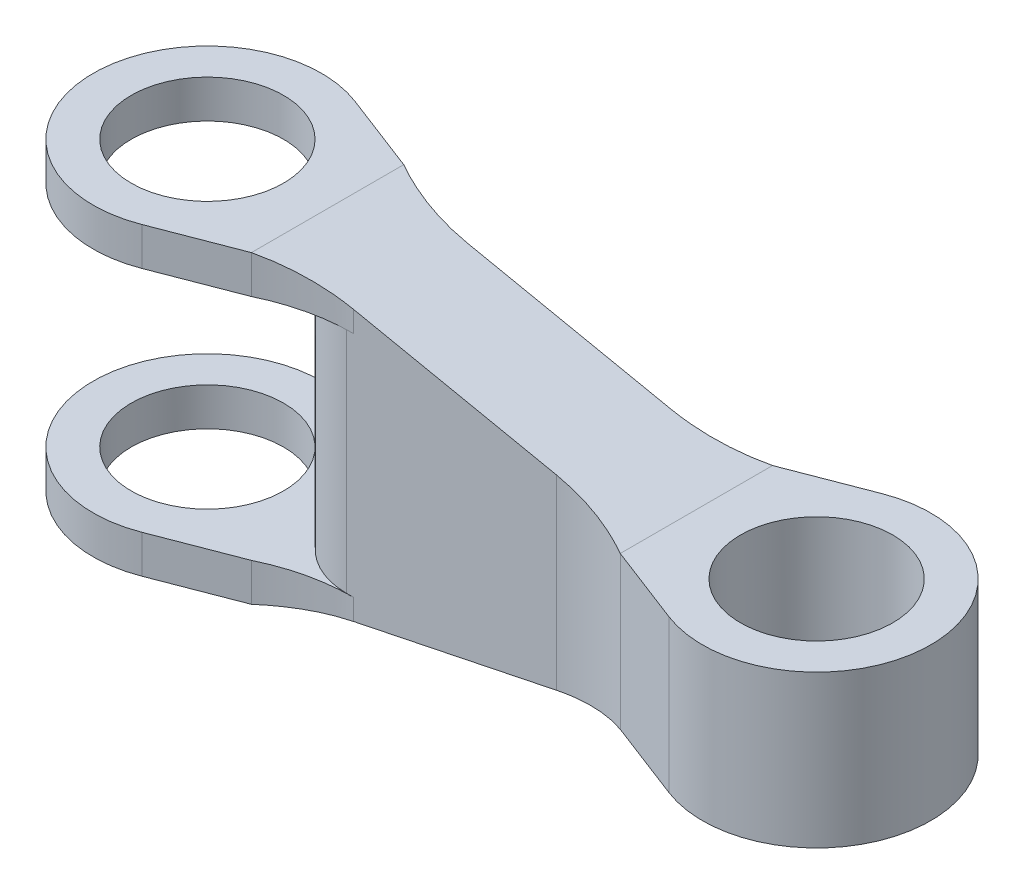
from build123d import *

# Parameters (mm, degrees)
SKETCH1_R           = 5.08
BOSS_EXTRUDE1_DEPTH = 10.16
SKETCH2_W           = 15.638324702
SKETCH2_H           = 15.24
CUT_EXTRUDE1_DEPTH  = 54.836616721
FILLET1_R           = 12.7
FILLET2_R           = 5.08


with BuildPart() as part:
    # Sketch1 → Boss-Extrude1 (new, symmetric)
    with BuildSketch(Plane(origin=(0, 0, 0), x_dir=(1, 0, 0), z_dir=(0, 1, 0))):
        with BuildLine():
            Line((2.735663722, 7.112), (8.018324702, 5.08))
            Line((8.018324702, 5.08), (8.018324702, 3.81))
            Line((8.018324702, 3.81), (32.621675298, 3.81))
            Line((32.621675298, 3.81), (32.621675298, 5.08))
            Line((32.621675298, 5.08), (37.904336278, 7.112))
            ThreePointArc((37.904336278, 7.112), (48.26, 0), (37.904336278, -7.112))
            Line((37.904336278, -7.112), (32.621675298, -5.08))
            Line((32.621675298, -5.08), (32.621675298, -3.81))
            Line((32.621675298, -3.81), (8.018324702, -3.81))
            Line((8.018324702, -3.81), (8.018324702, -5.08))
            Line((8.018324702, -5.08), (2.735663722, -7.112))
            ThreePointArc((2.735663722, -7.112), (-7.62, 0), (2.735663722, 7.112))
        make_face()
        with Locations(Location((0, 0, 0), (0, 0, 270))):
            Circle(SKETCH1_R, mode=Mode.SUBTRACT)
        with Locations(Location((40.64, 0, 0), (0, 0, 270))):
            Circle(SKETCH1_R, mode=Mode.SUBTRACT)
    extrude(amount=BOSS_EXTRUDE1_DEPTH, both=True)

    # Sketch2 → Cut-Extrude1 (cut, through all)
    with BuildSketch(Plane.XY.offset(13.97)):
        Polygon((8.018324702, 10.16), (32.621675298, 5.08), (48.26, 5.08), (48.26, 10.16), align=None)
        with Locations((0.199162351, 0)):
            Rectangle(SKETCH2_W, SKETCH2_H)
        Polygon((48.26, -10.16), (48.26, -5.08), (32.621675298, -5.08), (8.018324702, -10.16), align=None)
    extrude(amount=-CUT_EXTRUDE1_DEPTH, mode=Mode.SUBTRACT)

    # Fillet1
    # the kernel refuses this fillet: 12.7 mm, written as the material it adds along each edge
    with BuildSketch(Plane(origin=(32.621675298, 18.919504146, 3.81), x_dir=(-1, 0, 0), z_dir=(0, -1, 0))) as fillet1_piece_1_section:
        with BuildLine():
            CenterArc((5.535801658, -12.7), FILLET1_R, 90, 25.841932763)
            Line((0, -1.27), (0, 0))
            Line((0, 0), (5.535801658, 0))
        make_face()
    fillet1_piece_1 = extrude(amount=37.839008291, mode=Mode.PRIVATE)
    fillet1_piece_1 = split(fillet1_piece_1, bisect_by=Plane(origin=(37.374376864, -4.098681465, 3.81), z_dir=(-0.20221057606968723, 0.9793420663514691, 0)), keep=Keep.TOP, mode=Mode.PRIVATE)
    fillet1_piece_1 = split(fillet1_piece_1, bisect_by=Plane(origin=(29.880992297, 5.645885105, 3.81), z_dir=(-0.20221057606968723, -0.9793420663514691, 0)), keep=Keep.TOP, mode=Mode.PRIVATE)
    add(fillet1_piece_1)
    with BuildSketch(Plane(origin=(32.621675298, 18.919504146, -3.81), x_dir=(-1, 0, 0), z_dir=(0, -1, 0))) as fillet1_piece_2_section:
        with BuildLine():
            CenterArc((5.535801658, 12.7), FILLET1_R, 244.158067237, 25.841932763)
            Line((0, 1.27), (0, 0))
            Line((0, 0), (5.535801658, 0))
        make_face()
    fillet1_piece_2 = extrude(amount=37.839008291, mode=Mode.PRIVATE)
    fillet1_piece_2 = split(fillet1_piece_2, bisect_by=Plane(origin=(37.374376864, -4.098681465, -3.81), z_dir=(-0.20221057606968723, 0.9793420663514691, 0)), keep=Keep.TOP, mode=Mode.PRIVATE)
    fillet1_piece_2 = split(fillet1_piece_2, bisect_by=Plane(origin=(29.880992297, 5.645885105, -3.81), z_dir=(-0.20221057606968723, -0.9793420663514691, 0)), keep=Keep.TOP, mode=Mode.PRIVATE)
    add(fillet1_piece_2)
    with BuildSketch(Plane(origin=(8.018324702, -7.62, -3.81), x_dir=(1, 0, 0), z_dir=(0, -1, 0))) as fillet1_piece_3_section:
        with BuildLine():
            CenterArc((5.535801658, -12.7), FILLET1_R, 90, 25.841932763)
            Line((0, -1.27), (0, 0))
            Line((0, 0), (5.535801658, 0))
        make_face()
    fillet1_piece_3 = extrude(amount=16.379504146, mode=Mode.PRIVATE)
    fillet1_piece_3 = split(fillet1_piece_3, bisect_by=Plane(origin=(8.521329344, -10.056141643, -3.81), z_dir=(-0.20221057606968723, 0.9793420663514691, 0)), keep=Keep.TOP, mode=Mode.PRIVATE)
    add(fillet1_piece_3)
    with BuildSketch(Plane(origin=(8.018324702, 23.999504146, -3.81), x_dir=(1, 0, 0), z_dir=(0, -1, 0))) as fillet1_piece_4_section:
        with BuildLine():
            CenterArc((5.535801658, -12.7), FILLET1_R, 90, 25.841932763)
            Line((0, -1.27), (0, 0))
            Line((0, 0), (5.535801658, 0))
        make_face()
    fillet1_piece_4 = extrude(amount=16.379504146, mode=Mode.PRIVATE)
    fillet1_piece_4 = split(fillet1_piece_4, bisect_by=Plane(origin=(5.277641702, 10.725885105, -3.81), z_dir=(-0.20221057606968723, -0.9793420663514691, 0)), keep=Keep.TOP, mode=Mode.PRIVATE)
    add(fillet1_piece_4)
    with BuildSketch(Plane(origin=(8.018324702, -7.62, 3.81), x_dir=(0, 0, 1), z_dir=(0, -1, 0))) as fillet1_piece_5_section:
        with BuildLine():
            CenterArc((12.7, -5.535801658), FILLET1_R, 154.158067237, 25.841932763)
            Line((0, -5.535801658), (0, 0))
            Line((0, 0), (1.27, 0))
        make_face()
    fillet1_piece_5 = extrude(amount=16.379504146, mode=Mode.PRIVATE)
    fillet1_piece_5 = split(fillet1_piece_5, bisect_by=Plane(origin=(8.521329344, -10.056141643, 3.81), z_dir=(-0.20221057606968723, 0.9793420663514691, 0)), keep=Keep.TOP, mode=Mode.PRIVATE)
    add(fillet1_piece_5)
    with BuildSketch(Plane(origin=(8.018324702, 23.999504146, 3.81), x_dir=(0, 0, 1), z_dir=(0, -1, 0))) as fillet1_piece_6_section:
        with BuildLine():
            CenterArc((12.7, -5.535801658), FILLET1_R, 154.158067237, 25.841932763)
            Line((0, -5.535801658), (0, 0))
            Line((0, 0), (1.27, 0))
        make_face()
    fillet1_piece_6 = extrude(amount=16.379504146, mode=Mode.PRIVATE)
    fillet1_piece_6 = split(fillet1_piece_6, bisect_by=Plane(origin=(5.277641702, 10.725885105, 3.81), z_dir=(-0.20221057606968723, -0.9793420663514691, 0)), keep=Keep.TOP, mode=Mode.PRIVATE)
    add(fillet1_piece_6)

    # Fillet2
    # the kernel refuses this fillet: 5.08 mm, written as the material it takes off along each edge
    with BuildSketch(Plane(origin=(8.018324702, 7.62, -3.81), x_dir=(1, 0, 0), z_dir=(0, -1, 0)), Plane(origin=(8.018324702, 7.62, 3.81), x_dir=(0, 0, -1), z_dir=(0, -1, 0))) as fillet2_piece_1:
        with BuildLine():
            CenterArc((FILLET2_R, FILLET2_R), FILLET2_R, 180, 90)
            Line((0, FILLET2_R), (0, 0))
            Line((0, 0), (FILLET2_R, 0))
        make_face()
    extrude(amount=15.24, mode=Mode.SUBTRACT)


solid = part.part
